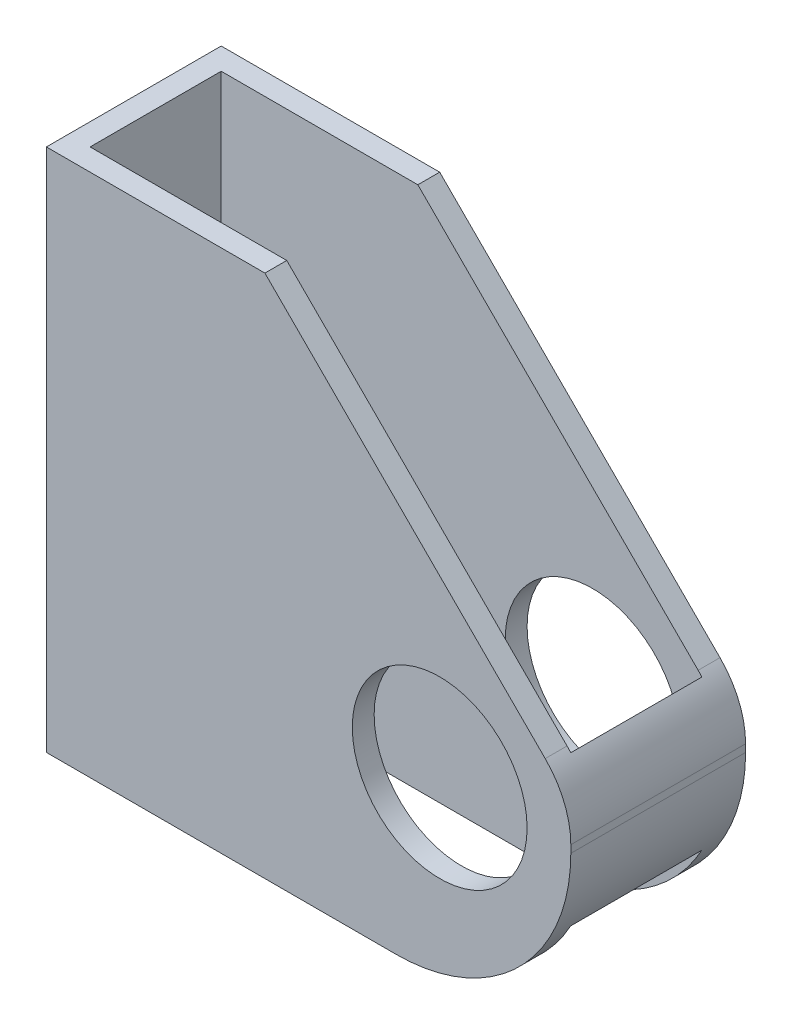
from build123d import *

# Parameters (mm, degrees)
SKETCH1_W                       = 76.2
SKETCH1_H                       = 76.2
SKETCH1_R                       = 12.7
BOSS_EXTRUDE1_DEPTH             = 12.7
CHAMFER1_SIZE                   = 44.45
FILLET1_R                       = 25.4
FILLET2_R                       = 12.7
CUT_EXTRUDE2_DEPTH              = 87.135590786
F_1_4_0_25_DIAMETER_HOLE1_D     = 6.35
F_1_4_0_25_DIAMETER_HOLE1_DEPTH = 5.08
F_1_4_0_25_DIAMETER_HOLE1_TIP   = 1.907732465


with BuildPart() as part:
    # Sketch1 → Boss-Extrude1 (new, symmetric)
    with BuildSketch(Plane.XY):
        Rectangle(SKETCH1_W, SKETCH1_H)
        with Locations((19.05, -12.7)):
            Circle(SKETCH1_R, mode=Mode.SUBTRACT)
    extrude(amount=BOSS_EXTRUDE1_DEPTH, both=True)

    # Chamfer1
    chamfer1_edges = [part.edges().sort_by_distance(p)[0] for p in [
        (38.1, 38.1, 0),
    ]]
    chamfer(chamfer1_edges, length=CHAMFER1_SIZE)

    # Fillet1
    fillet1_edges = [part.edges().sort_by_distance(p)[0] for p in [
        (38.1, -38.1, 0),
    ]]
    fillet(fillet1_edges, radius=FILLET1_R)

    # Fillet2
    fillet2_edges = [part.edges().sort_by_distance(p)[0] for p in [
        (38.1, -6.35, 0),
    ]]
    fillet(fillet2_edges, radius=FILLET2_R)

    # Sketch3 → Cut-Extrude2 (cut, through all)
    with BuildSketch(Plane.XZ.offset(38.1)):
        Polygon((-34.925, 9.525), (-34.925, -9.525), (12.7, -9.525), (34.925, -9.525), (34.925, 9.525), (12.7, 9.525), align=None)
    extrude(amount=-CUT_EXTRUDE2_DEPTH, mode=Mode.SUBTRACT)

    # 1/4 (0.25) Diameter Hole1
    with Locations(Plane.ZY.offset(38.1)):
        with Locations((0, 19.05), (0, -19.05)):
            Hole(F_1_4_0_25_DIAMETER_HOLE1_D / 2, depth=F_1_4_0_25_DIAMETER_HOLE1_DEPTH)
            with Locations((0, 0, -(F_1_4_0_25_DIAMETER_HOLE1_DEPTH + F_1_4_0_25_DIAMETER_HOLE1_TIP / 2))):  # 118° drill point
                Cone(0, F_1_4_0_25_DIAMETER_HOLE1_D / 2, F_1_4_0_25_DIAMETER_HOLE1_TIP, mode=Mode.SUBTRACT)


solid = part.part
